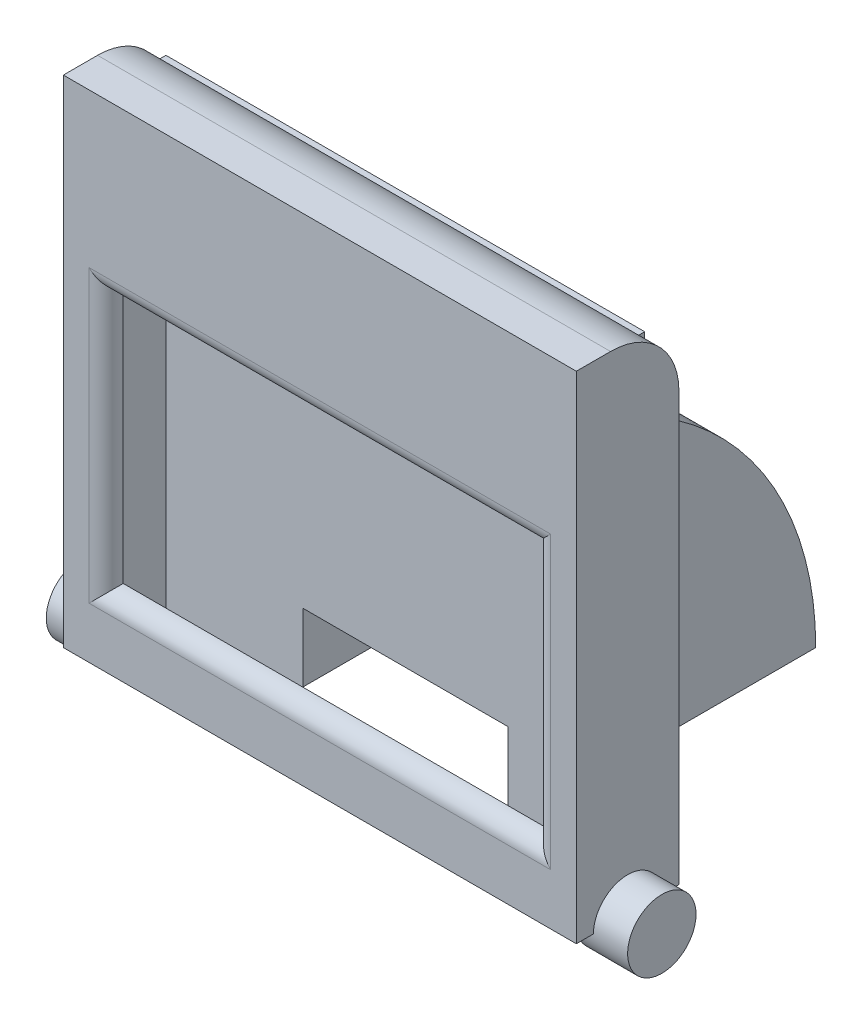
from build123d import *

# Parameters (mm, degrees)
ESQUISSE1_W              = 28
ESQUISSE1_H              = 28
BOSS_EXTRU_1_DEPTH       = 4
COQUE1_T                 = 1
ENL_V_MAT_EXTRU_1_REACH  = 43.449
ESQUISSE2_W              = 25
ESQUISSE2_H              = 15
CONG_1_R                 = 4
CONG_3_R                 = 1
ENL_V_MAT_EXTRU_13_REACH = 43.449
ESQUISSE21_W             = 12
ESQUISSE21_H             = 4
BOSS_EXTRU_8_START       = -15
BOSS_EXTRU_8_DEPTH       = 7
ESQUISSE26_W             = 12
ESQUISSE26_H             = 15
ENL_V_MAT_EXTRU_15_DEPTH = 4
BOSS_EXTRU_9_DEPTH       = 2
BOSS_EXTRU_9_DEPTH_BACK  = 1
ESQUISSE29_R             = 2
BOSS_EXTRU_10_DEPTH      = 2
BOSS_EXTRU_10_DEPTH_BACK = 1
ESQUISSE30_R             = 2


with BuildPart() as part:
    # Esquisse1 → Boss.-Extru.1 (new body)
    with BuildSketch(Plane.XY):
        with Locations((14, 14)):
            Rectangle(ESQUISSE1_W, ESQUISSE1_H)
    extrude(amount=BOSS_EXTRU_1_DEPTH)

    # Coque1
    coque1_openings = [part.faces().sort_by_distance(p)[0] for p in [
        (14, 0, 2),
    ]]
    offset(amount=COQUE1_T, openings=coque1_openings, kind=Kind.INTERSECTION)

    # Esquisse2 → Enlèv. mat.-Extru.1 (cut, up to next)
    with BuildSketch(Plane.XY.offset(5), mode=Mode.PRIVATE) as enl_v_mat_extru_1_sk1:
        with Locations((14, 11.5)):
            Rectangle(ESQUISSE2_W, ESQUISSE2_H)
    enl_v_mat_extru_1_tool1 = extrude(enl_v_mat_extru_1_sk1.sketch, amount=-ENL_V_MAT_EXTRU_1_REACH, mode=Mode.PRIVATE) & part.part
    add(enl_v_mat_extru_1_tool1.solids().sort_by_distance((14, 11.5, 5))[0], mode=Mode.SUBTRACT)

    # Congé1
    cong_1_edges = [part.edges().sort_by_distance(p)[0] for p in [
        (14, 29, -1),
    ]]
    fillet(cong_1_edges, radius=CONG_1_R)

    # Congé3
    cong_3_edges = [part.edges().sort_by_distance(p)[0] for p in [
        (26.5, 11.5, 5),
        (14, 19, 5),
        (1.5, 11.5, 5),
        (14, 4, 5),
    ]]
    fillet(cong_3_edges, radius=CONG_3_R - 0.0001)  # a hair under: the kernel refuses the full size

    # Esquisse21 → Enlèv. mat.-Extru.13 (cut, up to next)
    with BuildSketch(Plane(origin=(0, 0, -1), x_dir=(-1, 0, 0), z_dir=(0, 0, -1)), mode=Mode.PRIVATE) as enl_v_mat_extru_13_sk1:
        with Locations((-14, 2)):
            Rectangle(ESQUISSE21_W, ESQUISSE21_H)
    enl_v_mat_extru_13_tool1 = extrude(enl_v_mat_extru_13_sk1.sketch, amount=-ENL_V_MAT_EXTRU_13_REACH, mode=Mode.PRIVATE) & part.part
    add(enl_v_mat_extru_13_tool1.solids().sort_by_distance((14, 2, -1))[0], mode=Mode.SUBTRACT)

    # Esquisse24 → Boss.-Extru.8 (add, symmetric)
    with BuildSketch(Plane(origin=(29, 0, 0), x_dir=(0, 0, -1), z_dir=(1, 0, 0)).offset(BOSS_EXTRU_8_START)):
        with BuildLine():
            Line((1, 0), (17, 0))
            ThreePointArc((17, 0), (12.456832295, 12.328828006), (1, 18.761663039))
            Line((1, 18.761663039), (1, 0))
        make_face()
    extrude(amount=BOSS_EXTRU_8_DEPTH, both=True)

    # Esquisse26 → Enlèv. mat.-Extru.15 (cut)
    with BuildSketch(Plane.XZ):
        with Locations((14, -8.5)):
            Rectangle(ESQUISSE26_W, ESQUISSE26_H)
    extrude(amount=-ENL_V_MAT_EXTRU_15_DEPTH, mode=Mode.SUBTRACT)

    # Esquisse29 → Boss.-Extru.9 (add, two sides: drawn at the far end of the back side and taken through both)
    with BuildSketch(Plane(origin=(29, 0, 0), x_dir=(0, 0, -1), z_dir=(1, 0, 0)).offset(-BOSS_EXTRU_9_DEPTH_BACK)):
        with Locations((-2, 0)):
            Circle(ESQUISSE29_R)
    extrude(amount=BOSS_EXTRU_9_DEPTH + BOSS_EXTRU_9_DEPTH_BACK)

    # Esquisse30 → Boss.-Extru.10 (add, two sides: drawn at the far end of the back side and taken through both)
    with BuildSketch(Plane.ZY.offset(1).offset(-BOSS_EXTRU_10_DEPTH_BACK)):
        with Locations(Location((2, 0, 0), (0, 0, 180))):
            Circle(ESQUISSE30_R)
    extrude(amount=BOSS_EXTRU_10_DEPTH + BOSS_EXTRU_10_DEPTH_BACK)


solid = part.part
